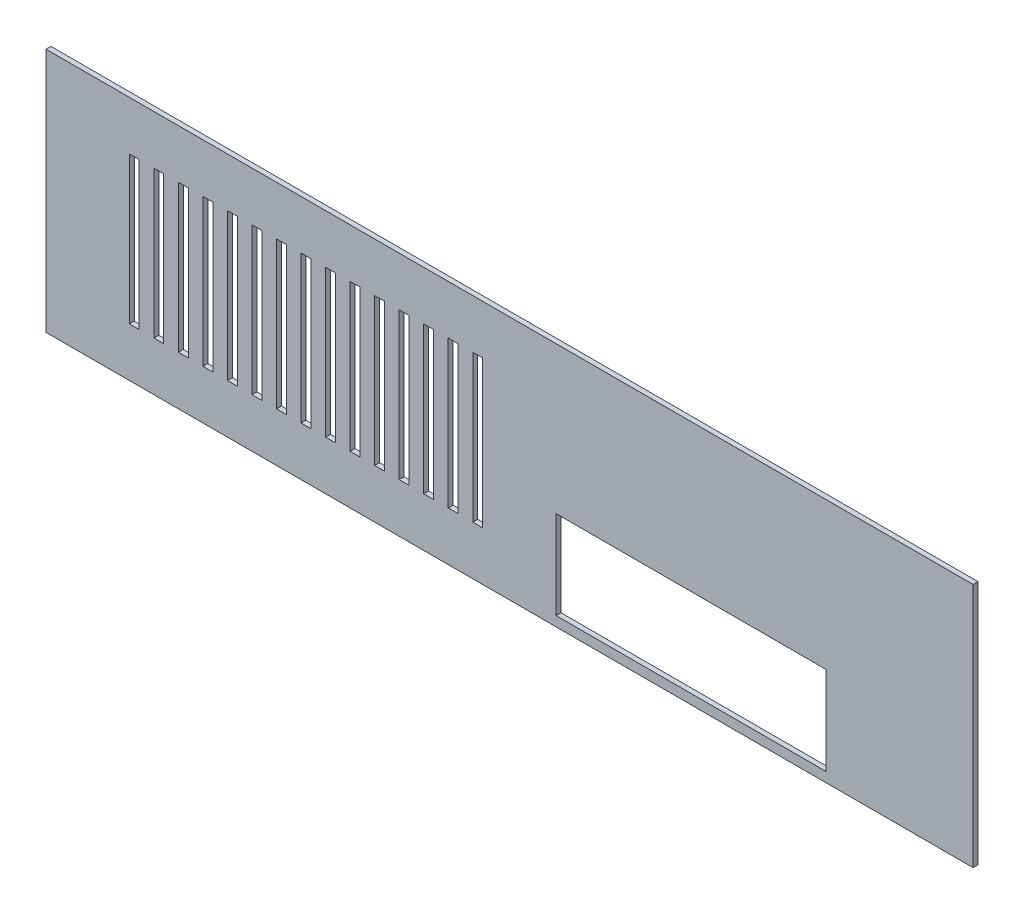
from build123d import *

# Parameters (mm, degrees)
SKETCH1_W           = 189
SKETCH1_H           = 50
BOSS_EXTRUDE1_DEPTH = 1
SKETCH2_W           = 55
SKETCH2_H           = 18
CUT_EXTRUDE1_DEPTH  = 134.866581758
SKETCH3_W           = 2
SKETCH3_H           = 30
CUT_EXTRUDE2_DEPTH  = 134.866581758


with BuildPart() as part:
    # Sketch1 → Boss-Extrude1 (new body)
    with BuildSketch(Plane.XY):
        with Locations((32.8655586, 16.198012015)):
            Rectangle(SKETCH1_W, SKETCH1_H)
    extrude(amount=BOSS_EXTRUDE1_DEPTH)

    # Sketch2 → Cut-Extrude1 (cut, through all)
    with BuildSketch(Plane.XY.offset(1)):
        with Locations((69.8655586, 2.198012015)):
            Rectangle(SKETCH2_W, SKETCH2_H)
    extrude(amount=-CUT_EXTRUDE1_DEPTH, mode=Mode.SUBTRACT)

    # Sketch3 → Cut-Extrude2 (cut, through all)
    with BuildSketch(Plane(origin=(0, 0, 0), x_dir=(-1, 0, 0), z_dir=(0, 0, -1))):
        with Locations((-26.3655586, 16.198012015)):
            Rectangle(SKETCH3_W, SKETCH3_H)
        with Locations((-21.3655586, 16.198012015)):
            Rectangle(SKETCH3_W, SKETCH3_H)
        with Locations((-16.3655586, 16.198012015)):
            Rectangle(SKETCH3_W, SKETCH3_H)
        with Locations((-11.3655586, 16.198012015)):
            Rectangle(SKETCH3_W, SKETCH3_H)
        with Locations((-6.3655586, 16.198012015)):
            Rectangle(SKETCH3_W, SKETCH3_H)
        with Locations((-1.3655586, 16.198012015)):
            Rectangle(SKETCH3_W, SKETCH3_H)
        with Locations((3.6344414, 16.198012015)):
            Rectangle(SKETCH3_W, SKETCH3_H)
        with Locations((8.6344414, 16.198012015)):
            Rectangle(SKETCH3_W, SKETCH3_H)
        with Locations((13.6344414, 16.198012015)):
            Rectangle(SKETCH3_W, SKETCH3_H)
        with Locations((18.6344414, 16.198012015)):
            Rectangle(SKETCH3_W, SKETCH3_H)
        with Locations((23.6344414, 16.198012015)):
            Rectangle(SKETCH3_W, SKETCH3_H)
        with Locations((28.6344414, 16.198012015)):
            Rectangle(SKETCH3_W, SKETCH3_H)
        with Locations((33.6344414, 16.198012015)):
            Rectangle(SKETCH3_W, SKETCH3_H)
        with Locations((38.6344414, 16.198012015)):
            Rectangle(SKETCH3_W, SKETCH3_H)
        with Locations((43.6344414, 16.198012015)):
            Rectangle(SKETCH3_W, SKETCH3_H)
    extrude(amount=-CUT_EXTRUDE2_DEPTH, mode=Mode.SUBTRACT)


solid = part.part
